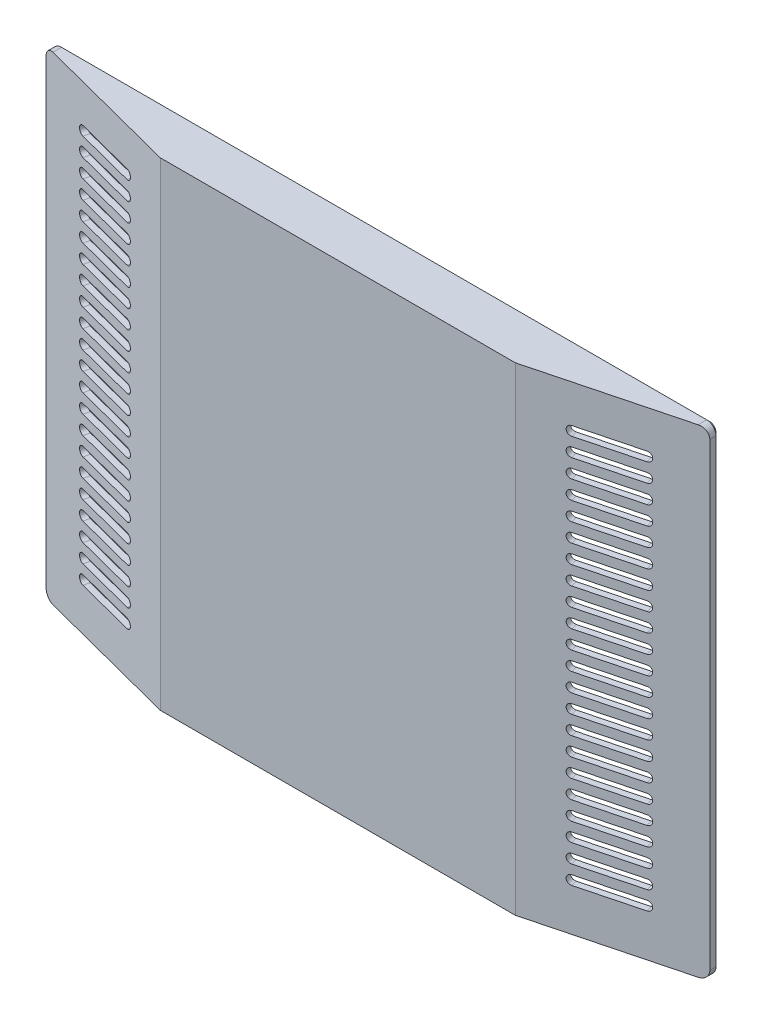
from build123d import *

# Parameters (mm, degrees)
SKETCH_1_W          = 215
SKETCH_1_H          = 155
EXTRUDE_1_DEPTH     = 15
CUT_EXTRUDE_1_DEPTH = 155
FILLET_1_R          = 3
SHELL_1_T           = -2
CUT_EXTRUDE_2_DEPTH = 3
EXTRUDE_2_DEPTH     = 1


with BuildPart() as part:
    # 草图1 → 凸台-拉伸1 (new body)
    with BuildSketch(Plane.XY):
        with Locations((107.5, -77.5)):
            Rectangle(SKETCH_1_W, SKETCH_1_H)
    extrude(amount=EXTRUDE_1_DEPTH)

    # 草图2 → 切除-拉伸1 (cut)
    with BuildSketch(Plane.XZ.offset(155)):
        Polygon((0, 2), (50, 15), (0, 15), align=None)
        Polygon((165, 15), (215, 15), (215, 2), align=None)
    extrude(amount=-CUT_EXTRUDE_1_DEPTH, mode=Mode.SUBTRACT)

    # 圆角1
    fillet_1_edges = [part.edges().sort_by_distance(p)[0] for p in [
        (215, 0, 1),
        (215, -155, 1),
        (0, 0, 1),
        (0, -155, 1),
    ]]
    fillet(fillet_1_edges, radius=FILLET_1_R)

    # 抽壳1
    shell_1_openings = [part.faces().sort_by_distance(p)[0] for p in [
        (107.5, -77.5, 0),
    ]]
    offset(amount=SHELL_1_T, openings=shell_1_openings, kind=Kind.INTERSECTION)

    # 草图3 → 切除-拉伸2 (cut)
    with BuildSketch(Plane(origin=(-0.48707381, 0, 1.873360809), x_dir=(0.967822506788272, 0, 0.2516338517649509), z_dir=(-0.2516338517649509, 0, 0.9678225067882721))):
        with BuildLine():
            Line((17.165633116, -12.25), (37.165633116, -12.25))
            ThreePointArc((37.165633116, -12.25), (38.665633116, -13.75), (37.165633116, -15.25))
            Line((37.165633116, -15.25), (17.165633116, -15.25))
            ThreePointArc((17.165633116, -15.25), (15.665633116, -13.75), (17.165633116, -12.25))
        make_face()
        with BuildLine():
            Line((17.165633116, -18.25), (37.165633116, -18.25))
            ThreePointArc((37.165633116, -18.25), (38.665633116, -19.75), (37.165633116, -21.25))
            Line((37.165633116, -21.25), (17.165633116, -21.25))
            ThreePointArc((17.165633116, -21.25), (15.665633116, -19.75), (17.165633116, -18.25))
        make_face()
        with BuildLine():
            Line((17.165633116, -24.25), (37.165633116, -24.25))
            ThreePointArc((37.165633116, -24.25), (38.665633116, -25.75), (37.165633116, -27.25))
            Line((37.165633116, -27.25), (17.165633116, -27.25))
            ThreePointArc((17.165633116, -27.25), (15.665633116, -25.75), (17.165633116, -24.25))
        make_face()
        with BuildLine():
            Line((17.165633116, -30.25), (37.165633116, -30.25))
            ThreePointArc((37.165633116, -30.25), (38.665633116, -31.75), (37.165633116, -33.25))
            Line((37.165633116, -33.25), (17.165633116, -33.25))
            ThreePointArc((17.165633116, -33.25), (15.665633116, -31.75), (17.165633116, -30.25))
        make_face()
        with BuildLine():
            Line((17.165633116, -36.25), (37.165633116, -36.25))
            ThreePointArc((37.165633116, -36.25), (38.665633116, -37.75), (37.165633116, -39.25))
            Line((37.165633116, -39.25), (17.165633116, -39.25))
            ThreePointArc((17.165633116, -39.25), (15.665633116, -37.75), (17.165633116, -36.25))
        make_face()
        with BuildLine():
            Line((17.165633116, -42.25), (37.165633116, -42.25))
            ThreePointArc((37.165633116, -42.25), (38.665633116, -43.75), (37.165633116, -45.25))
            Line((37.165633116, -45.25), (17.165633116, -45.25))
            ThreePointArc((17.165633116, -45.25), (15.665633116, -43.75), (17.165633116, -42.25))
        make_face()
        with BuildLine():
            Line((17.165633116, -48.25), (37.165633116, -48.25))
            ThreePointArc((37.165633116, -48.25), (38.665633116, -49.75), (37.165633116, -51.25))
            Line((37.165633116, -51.25), (17.165633116, -51.25))
            ThreePointArc((17.165633116, -51.25), (15.665633116, -49.75), (17.165633116, -48.25))
        make_face()
        with BuildLine():
            Line((17.165633116, -54.25), (37.165633116, -54.25))
            ThreePointArc((37.165633116, -54.25), (38.665633116, -55.75), (37.165633116, -57.25))
            Line((37.165633116, -57.25), (17.165633116, -57.25))
            ThreePointArc((17.165633116, -57.25), (15.665633116, -55.75), (17.165633116, -54.25))
        make_face()
        with BuildLine():
            Line((17.165633116, -60.25), (37.165633116, -60.25))
            ThreePointArc((37.165633116, -60.25), (38.665633116, -61.75), (37.165633116, -63.25))
            Line((37.165633116, -63.25), (17.165633116, -63.25))
            ThreePointArc((17.165633116, -63.25), (15.665633116, -61.75), (17.165633116, -60.25))
        make_face()
        with BuildLine():
            Line((17.165633116, -66.25), (37.165633116, -66.25))
            ThreePointArc((37.165633116, -66.25), (38.665633116, -67.75), (37.165633116, -69.25))
            Line((37.165633116, -69.25), (17.165633116, -69.25))
            ThreePointArc((17.165633116, -69.25), (15.665633116, -67.75), (17.165633116, -66.25))
        make_face()
        with BuildLine():
            Line((17.165633116, -72.25), (37.165633116, -72.25))
            ThreePointArc((37.165633116, -72.25), (38.665633116, -73.75), (37.165633116, -75.25))
            Line((37.165633116, -75.25), (17.165633116, -75.25))
            ThreePointArc((17.165633116, -75.25), (15.665633116, -73.75), (17.165633116, -72.25))
        make_face()
        with BuildLine():
            Line((17.165633116, -78.25), (37.165633116, -78.25))
            ThreePointArc((37.165633116, -78.25), (38.665633116, -79.75), (37.165633116, -81.25))
            Line((37.165633116, -81.25), (17.165633116, -81.25))
            ThreePointArc((17.165633116, -81.25), (15.665633116, -79.75), (17.165633116, -78.25))
        make_face()
        with BuildLine():
            Line((17.165633116, -84.25), (37.165633116, -84.25))
            ThreePointArc((37.165633116, -84.25), (38.665633116, -85.75), (37.165633116, -87.25))
            Line((37.165633116, -87.25), (17.165633116, -87.25))
            ThreePointArc((17.165633116, -87.25), (15.665633116, -85.75), (17.165633116, -84.25))
        make_face()
        with BuildLine():
            Line((17.165633116, -90.25), (37.165633116, -90.25))
            ThreePointArc((37.165633116, -90.25), (38.665633116, -91.75), (37.165633116, -93.25))
            Line((37.165633116, -93.25), (17.165633116, -93.25))
            ThreePointArc((17.165633116, -93.25), (15.665633116, -91.75), (17.165633116, -90.25))
        make_face()
        with BuildLine():
            Line((17.165633116, -96.25), (37.165633116, -96.25))
            ThreePointArc((37.165633116, -96.25), (38.665633116, -97.75), (37.165633116, -99.25))
            Line((37.165633116, -99.25), (17.165633116, -99.25))
            ThreePointArc((17.165633116, -99.25), (15.665633116, -97.75), (17.165633116, -96.25))
        make_face()
        with BuildLine():
            Line((17.165633116, -102.25), (37.165633116, -102.25))
            ThreePointArc((37.165633116, -102.25), (38.665633116, -103.75), (37.165633116, -105.25))
            Line((37.165633116, -105.25), (17.165633116, -105.25))
            ThreePointArc((17.165633116, -105.25), (15.665633116, -103.75), (17.165633116, -102.25))
        make_face()
        with BuildLine():
            Line((17.165633116, -108.25), (37.165633116, -108.25))
            ThreePointArc((37.165633116, -108.25), (38.665633116, -109.75), (37.165633116, -111.25))
            Line((37.165633116, -111.25), (17.165633116, -111.25))
            ThreePointArc((17.165633116, -111.25), (15.665633116, -109.75), (17.165633116, -108.25))
        make_face()
        with BuildLine():
            Line((17.165633116, -114.25), (37.165633116, -114.25))
            ThreePointArc((37.165633116, -114.25), (38.665633116, -115.75), (37.165633116, -117.25))
            Line((37.165633116, -117.25), (17.165633116, -117.25))
            ThreePointArc((17.165633116, -117.25), (15.665633116, -115.75), (17.165633116, -114.25))
        make_face()
        with BuildLine():
            Line((17.165633116, -120.25), (37.165633116, -120.25))
            ThreePointArc((37.165633116, -120.25), (38.665633116, -121.75), (37.165633116, -123.25))
            Line((37.165633116, -123.25), (17.165633116, -123.25))
            ThreePointArc((17.165633116, -123.25), (15.665633116, -121.75), (17.165633116, -120.25))
        make_face()
        with BuildLine():
            Line((17.165633116, -126.25), (37.165633116, -126.25))
            ThreePointArc((37.165633116, -126.25), (38.665633116, -127.75), (37.165633116, -129.25))
            Line((37.165633116, -129.25), (17.165633116, -129.25))
            ThreePointArc((17.165633116, -129.25), (15.665633116, -127.75), (17.165633116, -126.25))
        make_face()
        with BuildLine():
            Line((17.165633116, -132.25), (37.165633116, -132.25))
            ThreePointArc((37.165633116, -132.25), (38.665633116, -133.75), (37.165633116, -135.25))
            Line((37.165633116, -135.25), (17.165633116, -135.25))
            ThreePointArc((17.165633116, -135.25), (15.665633116, -133.75), (17.165633116, -132.25))
        make_face()
        with BuildLine():
            Line((17.165633116, -138.25), (37.165633116, -138.25))
            ThreePointArc((37.165633116, -138.25), (38.665633116, -139.75), (37.165633116, -141.25))
            Line((37.165633116, -141.25), (17.165633116, -141.25))
            ThreePointArc((17.165633116, -141.25), (15.665633116, -139.75), (17.165633116, -138.25))
        make_face()
    cut_extrude_2 = extrude(amount=-CUT_EXTRUDE_2_DEPTH, mode=Mode.SUBTRACT)

    # 镜向1: 切除-拉伸2 across plane
    add(cut_extrude_2.mirror(Plane(origin=(107.5, 0, 0), x_dir=(0, 0, 1), z_dir=(1, 0, 0))), mode=Mode.SUBTRACT)

    # 草图4 → 凸台-拉伸2 (add)
    with BuildSketch(Plane(origin=(0, 0, 0), x_dir=(-1, 0, 0), z_dir=(0, 0, -1))):
        with BuildLine():
            Line((-3, -1), (-212, -1))
            ThreePointArc((-212, -1), (-213.414213562, -1.585786438), (-214, -3))
            Line((-214, -3), (-214, -152))
            ThreePointArc((-214, -152), (-213.414213562, -153.414213562), (-212, -154))
            Line((-212, -154), (-3, -154))
            ThreePointArc((-3, -154), (-1.585786438, -153.414213562), (-1, -152))
            Line((-1, -152), (-1, -3))
            ThreePointArc((-1, -3), (-1.585786438, -1.585786438), (-3, -1))
        make_face()
        with BuildLine():
            Line((-3, -2), (-212, -2))
            ThreePointArc((-212, -2), (-212.707106781, -2.292893219), (-213, -3))
            Line((-213, -3), (-213, -152))
            ThreePointArc((-213, -152), (-212.707106781, -152.707106781), (-212, -153))
            Line((-212, -153), (-3, -153))
            ThreePointArc((-3, -153), (-2.292893219, -152.707106781), (-2, -152))
            Line((-2, -152), (-2, -3))
            ThreePointArc((-2, -3), (-2.292893219, -2.292893219), (-3, -2))
        make_face(mode=Mode.SUBTRACT)
    extrude(amount=EXTRUDE_2_DEPTH)


solid = part.part
